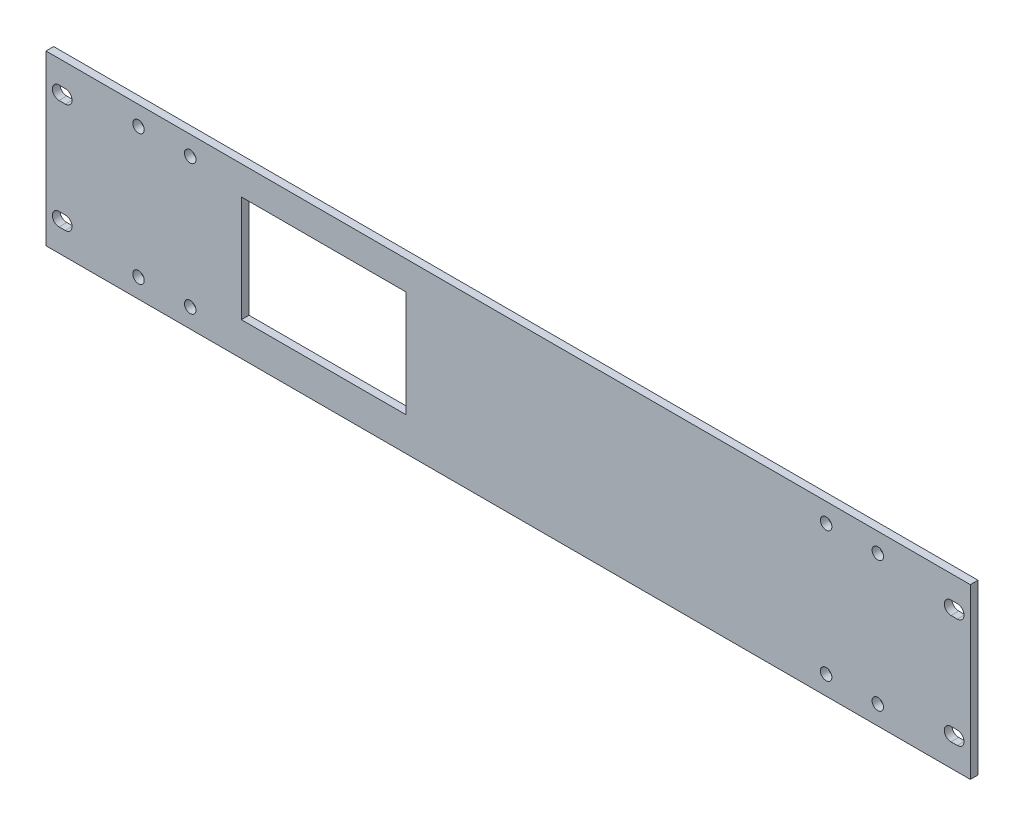
from build123d import *

# Parameters (mm, degrees)
SKETCH_1_W          = 482.6
SKETCH_1_H          = 88.1
EXTRUDE_1_DEPTH     = 4
CUT_EXTRUDE_1_DEPTH = 491.591856842
SKETCH_3_R          = 3
CUT_EXTRUDE_2_DEPTH = 491.591856842
SKETCH_4_W          = 86
SKETCH_4_H          = 55.5
CUT_EXTRUDE_3_DEPTH = 491.591856842


with BuildPart() as part:
    # Эскиз1 → Бобышка-Вытянуть1 (new body)
    with BuildSketch(Plane.XY):
        with Locations((241.3, 44.05)):
            Rectangle(SKETCH_1_W, SKETCH_1_H)
    extrude(amount=EXTRUDE_1_DEPTH)

    # Эскиз2 → Вырез-Вытянуть1 (cut, through all)
    with BuildSketch(Plane.XY.offset(4)):
        with BuildLine():
            Line((6.8, 76.12), (10.1, 76.12))
            ThreePointArc((10.1, 76.12), (13.6, 72.62), (10.1, 69.12))
            Line((10.1, 69.12), (6.8, 69.12))
            ThreePointArc((6.8, 69.12), (3.3, 72.62), (6.8, 76.12))
        make_face()
        with BuildLine():
            Line((472.5, 76.12), (475.8, 76.12))
            ThreePointArc((475.8, 76.12), (479.3, 72.62), (475.8, 69.12))
            Line((475.8, 69.12), (472.5, 69.12))
            ThreePointArc((472.5, 69.12), (469, 72.62), (472.5, 76.12))
        make_face()
        with BuildLine():
            Line((472.5, 18.97), (475.8, 18.97))
            ThreePointArc((475.8, 18.97), (479.3, 15.47), (475.8, 11.97))
            Line((475.8, 11.97), (472.5, 11.97))
            ThreePointArc((472.5, 11.97), (469, 15.47), (472.5, 18.97))
        make_face()
        with BuildLine():
            Line((6.8, 18.97), (10.1, 18.97))
            ThreePointArc((10.1, 18.97), (13.6, 15.47), (10.1, 11.97))
            Line((10.1, 11.97), (6.8, 11.97))
            ThreePointArc((6.8, 11.97), (3.3, 15.47), (6.8, 18.97))
        make_face()
    extrude(amount=-CUT_EXTRUDE_1_DEPTH, mode=Mode.SUBTRACT)

    # Эскиз3 → Вырез-Вытянуть2 (cut, through all)
    with BuildSketch(Plane.XY.offset(4)):
        with Locations((48.3, 78.1)):
            Circle(SKETCH_3_R)
        with Locations((434.3, 78.1)):
            Circle(SKETCH_3_R)
        with Locations((434.3, 10)):
            Circle(SKETCH_3_R)
        with Locations((48.3, 10)):
            Circle(SKETCH_3_R)
        with Locations((75.3, 78.1)):
            Circle(SKETCH_3_R)
        with Locations((407.3, 78.1)):
            Circle(SKETCH_3_R)
        with Locations((407.3, 10)):
            Circle(SKETCH_3_R)
        with Locations((75.3, 10)):
            Circle(SKETCH_3_R)
    extrude(amount=-CUT_EXTRUDE_2_DEPTH, mode=Mode.SUBTRACT)

    # Эскиз4 → Вырез-Вытянуть3 (cut, through all)
    with BuildSketch(Plane.XY.offset(4)):
        with Locations((145, 45.35)):
            Rectangle(SKETCH_4_W, SKETCH_4_H)
    extrude(amount=-CUT_EXTRUDE_3_DEPTH, mode=Mode.SUBTRACT)


solid = part.part
